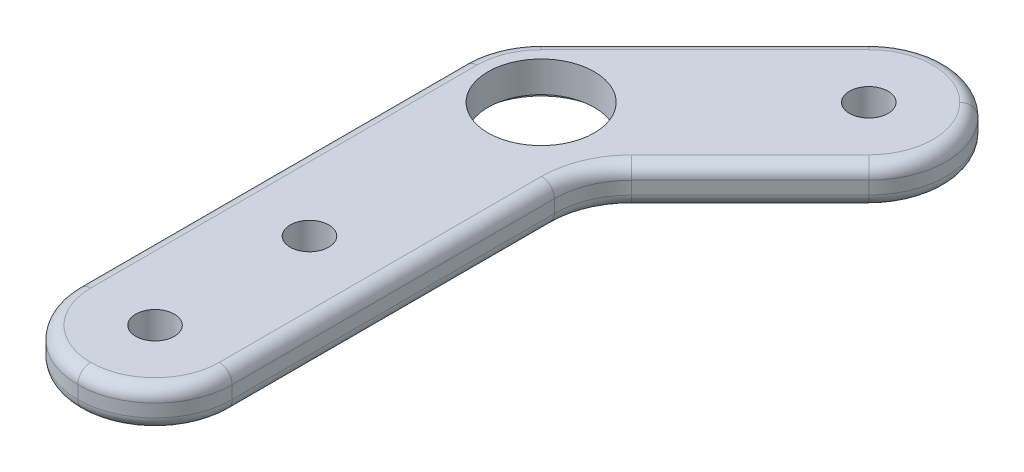
from build123d import *

# Parameters (mm, degrees)
SKETCH1_R           = 3.175
SKETCH1_R_2         = 12.7
SKETCH1_R_3         = 8.73125
BOSS_EXTRUDE1_DEPTH = 6.35
FILLET2_R           = 12.7
FILLET3_R           = 2.116666667
SKETCH3_R           = 10.2489
CUT_EXTRUDE1_DEPTH  = 1.27


with BuildPart() as part:
    # Sketch1 → Boss-Extrude1 (new body)
    # profile 1 of 4: a face of its own
    with BuildSketch(Plane(origin=(0, 0, 0), x_dir=(1, 0, 0), z_dir=(0, 1, 0))):
        with BuildLine():
            Line((-12.7, 31.75), (-12.7, -44.45))
            Line((-12.7, -44.45), (12.7, -44.45))
            Line((12.7, -44.45), (12.7, 26.489487758))
            Line((12.7, 26.489487758), (8.980256121, 22.769743879))
            ThreePointArc((8.980256121, 22.769743879), (-4.860079591, 20.016729937), (-12.7, 31.75))
        make_face()
        with Locations(Location((0, -31.75, 0), (0, 0, 270))):
            Circle(SKETCH1_R, mode=Mode.SUBTRACT)
        with Locations(Location((0, -6.35, 0), (0, 0, 270))):
            Circle(SKETCH1_R, mode=Mode.SUBTRACT)
    # profile 2 of 4: a face of its own
    with BuildSketch(Plane(origin=(0, 0, 0), x_dir=(1, 0, 0), z_dir=(0, 1, 0))):
        with Locations((0, 31.75)):
            Circle(SKETCH1_R_2)
        with Locations(Location((0, 31.75, 0), (0, 0, 270))):
            Circle(SKETCH1_R_3, mode=Mode.SUBTRACT)
    # profile 3 of 4: a face of its own
    with BuildSketch(Plane(origin=(0, 0, 0), x_dir=(1, 0, 0), z_dir=(0, 1, 0))):
        with BuildLine():
            Line((12.7, 31.75), (12.7, 26.489487758))
            Line((12.7, 26.489487758), (44.901280605, 58.690768363))
            Line((44.901280605, 58.690768363), (26.940768363, 76.651280605))
            Line((26.940768363, 76.651280605), (-8.980256121, 40.730256121))
            ThreePointArc((-8.980256121, 40.730256121), (4.860079591, 43.483270063), (12.7, 31.75))
        make_face()
        with Locations(Location((26.940768363, 58.690768363, 0), (0, 0, 270))):
            Circle(SKETCH1_R, mode=Mode.SUBTRACT)
    # profile 4 of 4: a face of its own
    with BuildSketch(Plane(origin=(0, 0, 0), x_dir=(1, 0, 0), z_dir=(0, 1, 0))):
        with BuildLine():
            Line((8.980256121, 22.769743879), (12.7, 26.489487758))
            Line((12.7, 26.489487758), (12.7, 31.75))
            ThreePointArc((12.7, 31.75), (11.733270063, 26.889920409), (8.980256121, 22.769743879))
        make_face()
    extrude(amount=BOSS_EXTRUDE1_DEPTH)

    # Fillet2
    fillet2_edges = [part.edges().sort_by_distance(p)[0] for p in [
        (12.7, 3.175, -26.489487758),
        (26.940768363, 3.175, -76.651280605),
        (44.901280605, 3.175, -58.690768363),
        (-12.7, 3.175, 44.45),
        (12.7, 3.175, 44.45),
    ]]
    fillet(fillet2_edges, radius=FILLET2_R - 0.0001)  # a hair under: the kernel refuses the full size

    # Fillet3
    fillet3_edges = [part.edges().sort_by_distance(p)[0] for p in [
        (-11.733270063, 6.35, -36.610079591),
        (-11.733270063, 0, -36.610079591),
        (26.170404892, 0, -39.95989265),
        (26.170404892, 6.35, -39.95989265),
        (12.7, 0, 5.260541531),
        (12.7, 6.35, 5.260541531),
        (4.490163416, 0, -54.200675658),
        (4.490163416, 6.35, -54.200675658),
        (-12.7, 0, 5e-05),
        (8.98028541, 0, 40.73028541),
        (-8.98028541, 0, 40.73028541),
        (39.640809785, 0, -58.690768363),
        (26.940768363, 0, -71.390809785),
        (-12.7, 6.35, 5e-05),
        (8.98028541, 6.35, 40.73028541),
        (-8.98028541, 6.35, 40.73028541),
        (39.640809785, 6.35, -58.690768363),
        (26.940768363, 6.35, -71.390809785),
        (13.666722325, 0, -26.08905826),
        (13.666722325, 6.35, -26.08905826),
    ]]
    fillet(fillet3_edges, radius=FILLET3_R)

    # Sketch3 → Cut-Extrude1 (cut)
    with BuildSketch(Plane.XZ):
        with Locations(Location((0, -31.75, 0), (0, 0, 270))):
            Circle(SKETCH3_R)
    extrude(amount=-CUT_EXTRUDE1_DEPTH, mode=Mode.SUBTRACT)


solid = part.part
